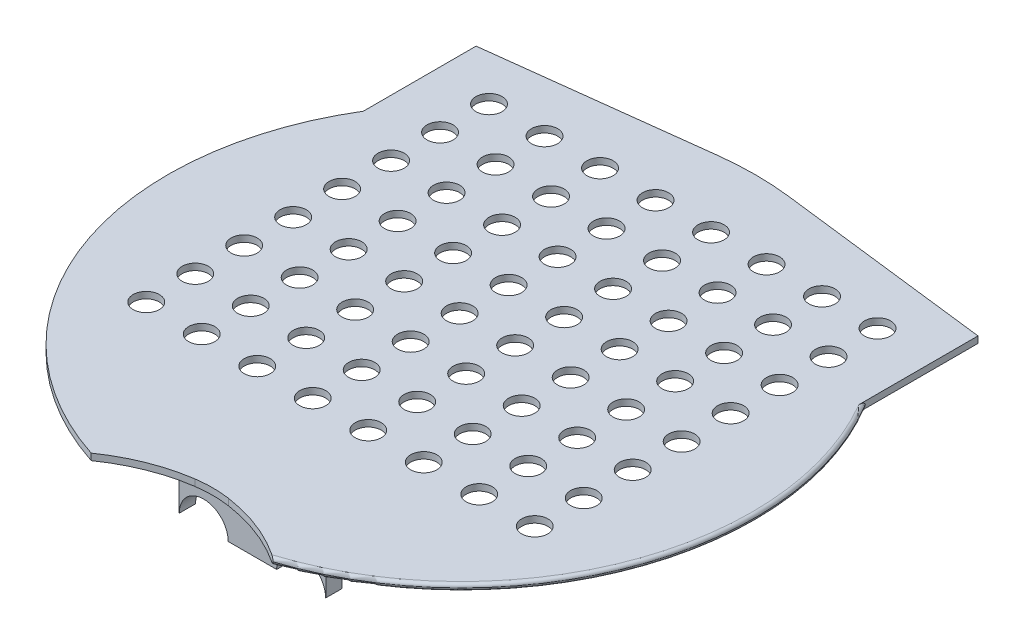
from build123d import *

# Parameters (mm, degrees)
BOSS_EXTRUDE2_DEPTH  = 1
MOTOR_SPACING_W      = 153.743038476
MOTOR_SPACING_H      = 35
BOSS_EXTRUDE6_DEPTH  = 2
FILLET4_START        = -1
FILLET4_DEPTH        = 2
FILLET6_R            = 35
FILLET7_R            = 1
PIR_ULTRA_W          = 45
PIR_ULTRA_H          = 5
BOSS_EXTRUDE10_DEPTH = 22
CUT_EXTRUDE4_DEPTH   = 22
SKETCH4_R            = 4
CUT_EXTRUDE5_DEPTH   = 10


with BuildPart() as part:
    # Top_lay → Boss-Extrude2 (new, symmetric)
    with BuildSketch(Plane(origin=(0, 0, 0), x_dir=(1, 0, 0), z_dir=(0, 1, 0))):
        with BuildLine():
            ThreePointArc((27.849459475, -85.582752976), (0, 90), (-27.849459475, -85.582752976))
            ThreePointArc((-27.849459475, -85.582752976), (-14.598708504, -78.839227398), (0, -76.022270085))
            ThreePointArc((0, -76.022270085), (14.598708504, -78.839227398), (27.849459475, -85.582752976))
        make_face()
    extrude(amount=BOSS_EXTRUDE2_DEPTH, both=True)

    # Motor_Spacing → Boss-Extrude6 (add)
    with BuildSketch(Plane(origin=(0, 1, 0), x_dir=(1, 0, 0), z_dir=(0, 1, 0))):
        with Locations((0, 63.828780022)):
            Rectangle(MOTOR_SPACING_W, MOTOR_SPACING_H)
    extrude(amount=-BOSS_EXTRUDE6_DEPTH)

    # Fillet4: read off the stored shape, not the designer's step
    # Fillet4 outline → Fillet4 (add)
    with BuildSketch(Plane(origin=(0, 0, 0), x_dir=(1, 0, 0), z_dir=(0, 1, 0)).offset(FILLET4_START)):
        with BuildLine():
            ThreePointArc((-38.543865143, 81.328780022), (-25.041990736, 86.445929343), (-10.895560747, 89.338047639))
            ThreePointArc((-10.895560747, 89.338047639), (-43.882431037, 85.324278863), (-76.871519238, 81.328780022))
            Line((-76.871519238, 81.328780022), (-38.543865143, 81.328780022))
        make_face()
        with BuildLine():
            ThreePointArc((76.871519238, 81.328780022), (43.882431037, 85.324278863), (10.895560747, 89.338047639))
            ThreePointArc((10.895560747, 89.338047639), (25.041990736, 86.445929343), (38.543865143, 81.328780022))
            Line((38.543865143, 81.328780022), (76.871519238, 81.328780022))
        make_face()
    extrude(amount=FILLET4_DEPTH)

    # Fillet6
    fillet6_edges = [part.edges().sort_by_distance(p)[0] for p in [
        (0, 0, 76.022270085),
    ]]
    fillet(fillet6_edges, radius=FILLET6_R)

    # Fillet7
    fillet7_edges = [part.edges().sort_by_distance(p)[0] for p in [
        (84.399606762, 1, 31.252301969),
        (84.399606762, -1, 31.252301969),
    ]]
    fillet(fillet7_edges, radius=FILLET7_R - 0.0001)  # a hair under: the kernel refuses the full size

    # PIR_ULTRA → Boss-Extrude10 (add)
    with BuildSketch(Plane.XZ.offset(1)):
        with Locations((0, 61.550217006)):
            Rectangle(PIR_ULTRA_W, PIR_ULTRA_H)
    extrude(amount=BOSS_EXTRUDE10_DEPTH)

    # Sketch3 → Cut-Extrude4 (cut)
    with BuildSketch(Plane.XY.offset(64.050217006)):
        with BuildLine():
            Line((-7.578758104, -23), (-7.421241896, -23))
            ThreePointArc((-7.421241896, -23), (-14.921241896, -15.5), (-22.421241896, -23))
            Line((-22.421241896, -23), (-7.578758104, -23))
        make_face()
        with BuildLine():
            ThreePointArc((22.421241896, -23), (14.921241896, -15.5), (7.421241896, -23))
            Line((7.421241896, -23), (22.421241896, -23))
        make_face()
    extrude(amount=-CUT_EXTRUDE4_DEPTH, mode=Mode.SUBTRACT)

    # Sketch4 → Cut-Extrude5 (cut)
    with BuildSketch(Plane.XZ.offset(1)):
        with Locations(Location((-59.5, -67.926375212, 0), (0, 0, 270))):
            Circle(SKETCH4_R)
        with Locations(Location((-25.5, -67.926375212, 0), (0, 0, 270))):
            Circle(SKETCH4_R)
        with Locations(Location((-42.5, -67.926375212, 0), (0, 0, 270))):
            Circle(SKETCH4_R)
        with Locations(Location((-8.5, -67.926375212, 0), (0, 0, 270))):
            Circle(SKETCH4_R)
        with Locations(Location((8.5, -67.926375212, 0), (0, 0, 270))):
            Circle(SKETCH4_R)
        with Locations(Location((25.5, -67.926375212, 0), (0, 0, 270))):
            Circle(SKETCH4_R)
        with Locations(Location((42.5, -67.926375212, 0), (0, 0, 270))):
            Circle(SKETCH4_R)
        with Locations(Location((59.5, -67.926375212, 0), (0, 0, 270))):
            Circle(SKETCH4_R)
        with Locations(Location((-59.5, -52.926375212, 0), (0, 0, 270))):
            Circle(SKETCH4_R)
        with Locations(Location((25.5, -52.926375212, 0), (0, 0, 270))):
            Circle(SKETCH4_R)
        with Locations(Location((-42.5, -52.926375212, 0), (0, 0, 270))):
            Circle(SKETCH4_R)
        with Locations(Location((-25.5, -52.926375212, 0), (0, 0, 270))):
            Circle(SKETCH4_R)
        with Locations(Location((8.5, -52.926375212, 0), (0, 0, 270))):
            Circle(SKETCH4_R)
        with Locations(Location((42.5, -52.926375212, 0), (0, 0, 270))):
            Circle(SKETCH4_R)
        with Locations(Location((59.5, -52.926375212, 0), (0, 0, 270))):
            Circle(SKETCH4_R)
        with Locations(Location((-8.5, -52.926375212, 0), (0, 0, 270))):
            Circle(SKETCH4_R)
        with Locations(Location((-59.5, -37.926375212, 0), (0, 0, 270))):
            Circle(SKETCH4_R)
        with Locations(Location((25.5, -37.926375212, 0), (0, 0, 270))):
            Circle(SKETCH4_R)
        with Locations(Location((-42.5, -37.926375212, 0), (0, 0, 270))):
            Circle(SKETCH4_R)
        with Locations(Location((-25.5, -37.926375212, 0), (0, 0, 270))):
            Circle(SKETCH4_R)
        with Locations(Location((8.5, -37.926375212, 0), (0, 0, 270))):
            Circle(SKETCH4_R)
        with Locations(Location((42.5, -37.926375212, 0), (0, 0, 270))):
            Circle(SKETCH4_R)
        with Locations(Location((59.5, -37.926375212, 0), (0, 0, 270))):
            Circle(SKETCH4_R)
        with Locations(Location((-8.5, -37.926375212, 0), (0, 0, 270))):
            Circle(SKETCH4_R)
        with Locations(Location((-59.5, -22.926375212, 0), (0, 0, 270))):
            Circle(SKETCH4_R)
        with Locations(Location((25.5, -22.926375212, 0), (0, 0, 270))):
            Circle(SKETCH4_R)
        with Locations(Location((-42.5, -22.926375212, 0), (0, 0, 270))):
            Circle(SKETCH4_R)
        with Locations(Location((-25.5, -22.926375212, 0), (0, 0, 270))):
            Circle(SKETCH4_R)
        with Locations(Location((8.5, -22.926375212, 0), (0, 0, 270))):
            Circle(SKETCH4_R)
        with Locations(Location((42.5, -22.926375212, 0), (0, 0, 270))):
            Circle(SKETCH4_R)
        with Locations(Location((59.5, -22.926375212, 0), (0, 0, 270))):
            Circle(SKETCH4_R)
        with Locations(Location((-8.5, -22.926375212, 0), (0, 0, 270))):
            Circle(SKETCH4_R)
        with Locations(Location((-59.5, -7.926375212, 0), (0, 0, 270))):
            Circle(SKETCH4_R)
        with Locations(Location((25.5, -7.926375212, 0), (0, 0, 270))):
            Circle(SKETCH4_R)
        with Locations(Location((-42.5, -7.926375212, 0), (0, 0, 270))):
            Circle(SKETCH4_R)
        with Locations(Location((-25.5, -7.926375212, 0), (0, 0, 270))):
            Circle(SKETCH4_R)
        with Locations(Location((8.5, -7.926375212, 0), (0, 0, 270))):
            Circle(SKETCH4_R)
        with Locations(Location((42.5, -7.926375212, 0), (0, 0, 270))):
            Circle(SKETCH4_R)
        with Locations(Location((59.5, -7.926375212, 0), (0, 0, 270))):
            Circle(SKETCH4_R)
        with Locations(Location((-8.5, -7.926375212, 0), (0, 0, 270))):
            Circle(SKETCH4_R)
        with Locations(Location((-59.5, 7.073624788, 0), (0, 0, 270))):
            Circle(SKETCH4_R)
        with Locations(Location((25.5, 7.073624788, 0), (0, 0, 270))):
            Circle(SKETCH4_R)
        with Locations(Location((-42.5, 7.073624788, 0), (0, 0, 270))):
            Circle(SKETCH4_R)
        with Locations(Location((-25.5, 7.073624788, 0), (0, 0, 270))):
            Circle(SKETCH4_R)
        with Locations(Location((8.5, 7.073624788, 0), (0, 0, 270))):
            Circle(SKETCH4_R)
        with Locations(Location((42.5, 7.073624788, 0), (0, 0, 270))):
            Circle(SKETCH4_R)
        with Locations(Location((59.5, 7.073624788, 0), (0, 0, 270))):
            Circle(SKETCH4_R)
        with Locations(Location((-8.5, 7.073624788, 0), (0, 0, 270))):
            Circle(SKETCH4_R)
        with Locations(Location((-59.5, 22.073624788, 0), (0, 0, 270))):
            Circle(SKETCH4_R)
        with Locations(Location((25.5, 22.073624788, 0), (0, 0, 270))):
            Circle(SKETCH4_R)
        with Locations(Location((-42.5, 22.073624788, 0), (0, 0, 270))):
            Circle(SKETCH4_R)
        with Locations(Location((-25.5, 22.073624788, 0), (0, 0, 270))):
            Circle(SKETCH4_R)
        with Locations(Location((8.5, 22.073624788, 0), (0, 0, 270))):
            Circle(SKETCH4_R)
        with Locations(Location((42.5, 22.073624788, 0), (0, 0, 270))):
            Circle(SKETCH4_R)
        with Locations(Location((59.5, 22.073624788, 0), (0, 0, 270))):
            Circle(SKETCH4_R)
        with Locations(Location((-8.5, 22.073624788, 0), (0, 0, 270))):
            Circle(SKETCH4_R)
        with Locations(Location((-59.5, 37.073624788, 0), (0, 0, 270))):
            Circle(SKETCH4_R)
        with Locations(Location((25.5, 37.073624788, 0), (0, 0, 270))):
            Circle(SKETCH4_R)
        with Locations(Location((-42.5, 37.073624788, 0), (0, 0, 270))):
            Circle(SKETCH4_R)
        with Locations(Location((-25.5, 37.073624788, 0), (0, 0, 270))):
            Circle(SKETCH4_R)
        with Locations(Location((8.5, 37.073624788, 0), (0, 0, 270))):
            Circle(SKETCH4_R)
        with Locations(Location((42.5, 37.073624788, 0), (0, 0, 270))):
            Circle(SKETCH4_R)
        with Locations(Location((59.5, 37.073624788, 0), (0, 0, 270))):
            Circle(SKETCH4_R)
        with Locations(Location((-8.5, 37.073624788, 0), (0, 0, 270))):
            Circle(SKETCH4_R)
    extrude(amount=-CUT_EXTRUDE5_DEPTH, mode=Mode.SUBTRACT)


solid = part.part
